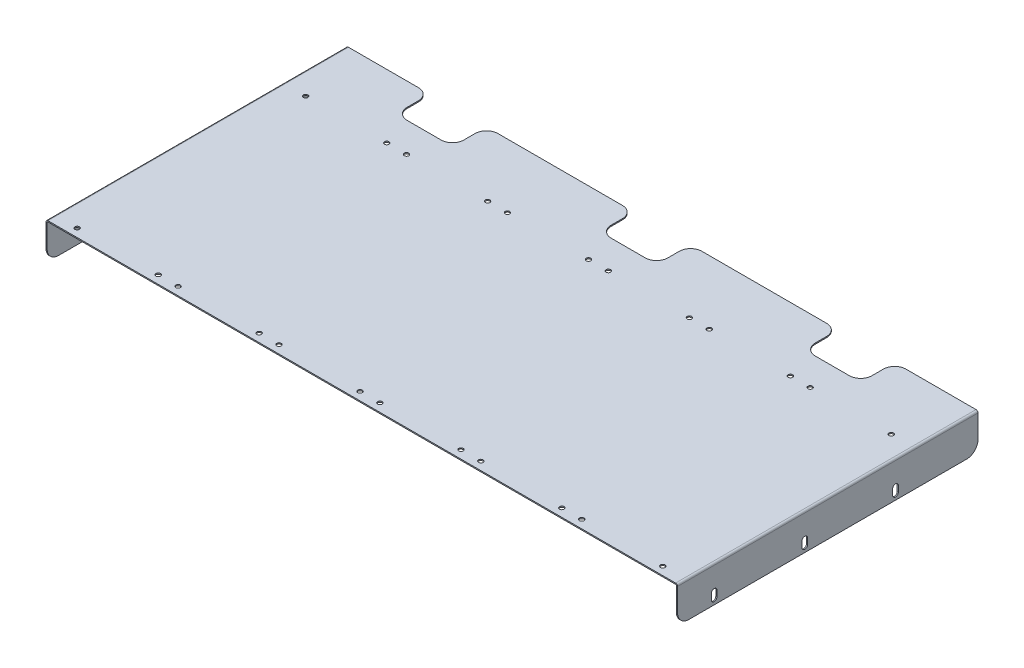
from build123d import *

# Parameters (mm, degrees)
SZKIC2_W                             = 555
SZKIC2_H                             = 265
ODGI_CIE_BAZOWE1_DEPTH               = 1
ODGI_CIE_KRAW_DZI1_STRIP_W           = 5.4732
ODGI_CIE_KRAW_DZI1_STRIP_H           = 1
ODGI_CIE_KRAW_DZI1_STRIP_CUT_DEPTH   = 265
ODGI_CIE_KRAW_DZI1_STRIP_2_W         = 5.4732
ODGI_CIE_KRAW_DZI1_STRIP_2_H         = 1
ODGI_CIE_KRAW_DZI1_STRIP_CUT_2_DEPTH = 265
ODGI_CIE_KRAW_DZI1_DEPTH             = 265
ODGI_CIE_KRAW_DZI1_BEND_DEPTH        = 265
WYTNIJ_WYCI_GNI_CIE3_DEPTH           = 574.436352179
ZAOKR_GLENIE2_R                      = 10
SZKIC16_R                            = 2
WYTNIJ_WYCI_GNI_CIE4_DEPTH           = 10
WYTNIJ_WYCI_GNI_CIE5_DEPTH           = 10
ZAOKR_GLENIE3_R                      = 10


# Sheet-metal steps are written as plain solids
with BuildPart() as part:
    # Szkic2 → Odgięcie bazowe1 (new body)
    with BuildSketch(Plane(origin=(0, 0, 0), x_dir=(1, 0, 0), z_dir=(0, 1, 0))):
        Rectangle(SZKIC2_W, SZKIC2_H)
    extrude(amount=-ODGI_CIE_BAZOWE1_DEPTH)

    # Odgięcie krawędzi1 strip (across the edge) → Odgięcie krawędzi1 strip cut (cut)
    with BuildSketch(Plane(origin=(-277.5, -1, 132.5), x_dir=(1, 0, 0), z_dir=(0, 0, -1))):
        with Locations((-2, -0.5)):
            Rectangle(ODGI_CIE_KRAW_DZI1_STRIP_W, ODGI_CIE_KRAW_DZI1_STRIP_H)
    extrude(amount=ODGI_CIE_KRAW_DZI1_STRIP_CUT_DEPTH, mode=Mode.SUBTRACT)

    # Odgięcie krawędzi1 strip 2 (across the edge) → Odgięcie krawędzi1 strip cut 2 (cut)
    with BuildSketch(Plane(origin=(277.5, -1, -132.5), x_dir=(-1, 0, 0), z_dir=(0, 0, 1))):
        with Locations((-2, -0.5)):
            Rectangle(ODGI_CIE_KRAW_DZI1_STRIP_2_W, ODGI_CIE_KRAW_DZI1_STRIP_2_H)
    extrude(amount=ODGI_CIE_KRAW_DZI1_STRIP_CUT_2_DEPTH, mode=Mode.SUBTRACT)

    # Odgięcie krawędzi1 section (across the edge) → Odgięcie krawędzi1 (add)
    with BuildSketch(Plane(origin=(-277.5, -1, 132.5), x_dir=(1, 0, 0), z_dir=(0, 0, -1))):
        with BuildLine():
            Line((-1, 0.7366), (-1, 31))
            Line((-1, 31), (0, 31))
            Line((0, 31), (0, 0.7366))
            ThreePointArc((0, 0.7366), (0.215745145, 0.215745145), (0.7366, 0))
            Line((0.7366, 0), (0.7366, -1))
            ThreePointArc((0.7366, -1), (-0.491361636, -0.491361636), (-1, 0.7366))
        make_face()
    extrude(amount=ODGI_CIE_KRAW_DZI1_DEPTH)

    # Odgięcie krawędzi1 section 2 (across the edge) → Odgięcie krawędzi1 bend (add)
    with BuildSketch(Plane(origin=(277.5, -1, -132.5), x_dir=(-1, 0, 0), z_dir=(0, 0, 1))):
        with BuildLine():
            Line((-1, 0.7366), (-1, 31))
            Line((-1, 31), (0, 31))
            Line((0, 31), (0, 0.7366))
            ThreePointArc((0, 0.7366), (0.215745145, 0.215745145), (0.7366, 0))
            Line((0.7366, 0), (0.7366, -1))
            ThreePointArc((0.7366, -1), (-0.491361636, -0.491361636), (-1, 0.7366))
        make_face()
    extrude(amount=ODGI_CIE_KRAW_DZI1_BEND_DEPTH)

    # Szkic15 → Wytnij-wyciągnięcie3 (cut, through all)
    with BuildSketch(Plane(origin=(278.5, 0, 0), x_dir=(0, 0, -1), z_dir=(1, 0, 0))):
        with BuildLine():
            Line((-97.75, -22), (-97.75, -27))
            ThreePointArc((-97.75, -27), (-100.25, -29.5), (-102.75, -27))
            Line((-102.75, -27), (-102.75, -22))
            ThreePointArc((-102.75, -22), (-100.25, -19.5), (-97.75, -22))
        make_face()
        with BuildLine():
            Line((-22.75, -22), (-22.75, -27))
            ThreePointArc((-22.75, -27), (-20.25, -29.5), (-17.75, -27))
            Line((-17.75, -27), (-17.75, -22))
            ThreePointArc((-17.75, -22), (-20.25, -19.5), (-22.75, -22))
        make_face()
        with BuildLine():
            Line((57.25, -22), (57.25, -27))
            ThreePointArc((57.25, -27), (59.75, -29.5), (62.25, -27))
            Line((62.25, -27), (62.25, -22))
            ThreePointArc((62.25, -22), (59.75, -19.5), (57.25, -22))
        make_face()
    extrude(amount=-WYTNIJ_WYCI_GNI_CIE3_DEPTH, mode=Mode.SUBTRACT)

    # Zaokrąglenie2
    zaokr_glenie2_edges = [part.edges().sort_by_distance(p)[0] for p in [
        (-278, -32, 132.5),
        (-278, -32, -132.5),
        (278, -32, -132.5),
        (278, -32, 132.5),
    ]]
    fillet(zaokr_glenie2_edges, radius=ZAOKR_GLENIE2_R)

    # Szkic16 → Wytnij-wyciągnięcie4 (cut)
    with BuildSketch(Plane(origin=(0, 0, 0), x_dir=(1, 0, 0), z_dir=(0, 1, 0))):
        with Locations(Location((-258.25, -125.25, 0), (0, 0, 270))):
            Circle(SZKIC16_R)
        with Locations(Location((-186.75, -125.25, 0), (0, 0, 270))):
            Circle(SZKIC16_R)
        with Locations(Location((-258.25, 76.25, 0), (0, 0, 270))):
            Circle(SZKIC16_R)
        with Locations(Location((-186.75, 76.25, 0), (0, 0, 270))):
            Circle(SZKIC16_R)
        with Locations(Location((-169.25, 76.25, 0), (0, 0, 270))):
            Circle(SZKIC16_R)
        with Locations(Location((-97.75, 76.25, 0), (0, 0, 270))):
            Circle(SZKIC16_R)
        with Locations(Location((-169.25, -125.25, 0), (0, 0, 270))):
            Circle(SZKIC16_R)
        with Locations(Location((-97.75, -125.25, 0), (0, 0, 270))):
            Circle(SZKIC16_R)
        with Locations(Location((-80.25, 76.25, 0), (0, 0, 270))):
            Circle(SZKIC16_R)
        with Locations(Location((-8.75, 76.25, 0), (0, 0, 270))):
            Circle(SZKIC16_R)
        with Locations(Location((-80.25, -125.25, 0), (0, 0, 270))):
            Circle(SZKIC16_R)
        with Locations(Location((-8.75, -125.25, 0), (0, 0, 270))):
            Circle(SZKIC16_R)
        with Locations(Location((8.75, 76.25, 0), (0, 0, 270))):
            Circle(SZKIC16_R)
        with Locations(Location((80.25, 76.25, 0), (0, 0, 270))):
            Circle(SZKIC16_R)
        with Locations(Location((8.75, -125.25, 0), (0, 0, 270))):
            Circle(SZKIC16_R)
        with Locations(Location((80.25, -125.25, 0), (0, 0, 270))):
            Circle(SZKIC16_R)
        with Locations(Location((97.75, 76.25, 0), (0, 0, 270))):
            Circle(SZKIC16_R)
        with Locations(Location((169.25, 76.25, 0), (0, 0, 270))):
            Circle(SZKIC16_R)
        with Locations(Location((97.75, -125.25, 0), (0, 0, 270))):
            Circle(SZKIC16_R)
        with Locations(Location((169.25, -125.25, 0), (0, 0, 270))):
            Circle(SZKIC16_R)
        with Locations(Location((186.75, 76.25, 0), (0, 0, 270))):
            Circle(SZKIC16_R)
        with Locations(Location((258.25, 76.25, 0), (0, 0, 270))):
            Circle(SZKIC16_R)
        with Locations(Location((186.75, -125.25, 0), (0, 0, 270))):
            Circle(SZKIC16_R)
        with Locations(Location((258.25, -125.25, 0), (0, 0, 270))):
            Circle(SZKIC16_R)
    extrude(amount=-WYTNIJ_WYCI_GNI_CIE4_DEPTH, mode=Mode.SUBTRACT)

    # Szkic17 → Wytnij-wyciągnięcie5 (cut)
    with BuildSketch(Plane(origin=(0, 0, 0), x_dir=(1, 0, 0), z_dir=(0, 1, 0))):
        with BuildLine():
            Line((15, 102.5), (-15, 102.5))
            ThreePointArc((-15, 102.5), (-22.071067812, 105.428932188), (-25, 112.5))
            Line((-25, 112.5), (-25, 132.5))
            Line((-25, 132.5), (25, 132.5))
            Line((25, 132.5), (25, 112.5))
            ThreePointArc((25, 112.5), (22.071067812, 105.428932188), (15, 102.5))
        make_face()
        with BuildLine():
            Line((155, 132.5), (205, 132.5))
            Line((205, 132.5), (205, 112.5))
            ThreePointArc((205, 112.5), (202.071067812, 105.428932188), (195, 102.5))
            Line((195, 102.5), (165, 102.5))
            ThreePointArc((165, 102.5), (157.928932188, 105.428932188), (155, 112.5))
            Line((155, 112.5), (155, 132.5))
        make_face()
        with BuildLine():
            Line((-155, 112.5), (-155, 132.5))
            Line((-155, 132.5), (-205, 132.5))
            Line((-205, 132.5), (-205, 112.5))
            ThreePointArc((-205, 112.5), (-202.071067812, 105.428932188), (-195, 102.5))
            Line((-195, 102.5), (-165, 102.5))
            ThreePointArc((-165, 102.5), (-157.928932188, 105.428932188), (-155, 112.5))
        make_face()
    extrude(amount=-WYTNIJ_WYCI_GNI_CIE5_DEPTH, mode=Mode.SUBTRACT)

    # Zaokrąglenie3
    zaokr_glenie3_edges = [part.edges().sort_by_distance(p)[0] for p in [
        (25, -0.5, -132.5),
        (-25, -0.5, -132.5),
        (-155, -0.5, -132.5),
        (-205, -0.5, -132.5),
        (205, -0.5, -132.5),
        (155, -0.5, -132.5),
    ]]
    fillet(zaokr_glenie3_edges, radius=ZAOKR_GLENIE3_R)


solid = part.part
